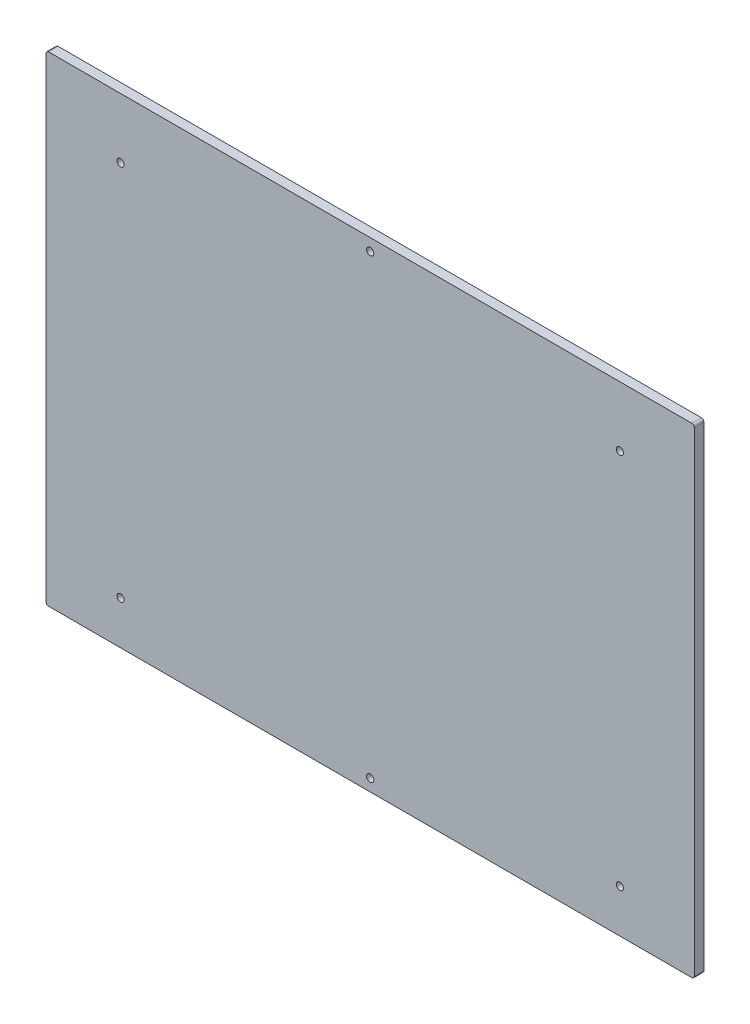
from build123d import *

# Parameters (mm, degrees)
SKETCH_1_W             = 270
SKETCH_1_H             = 200
SM_BASE_FLANGE_1_DEPTH = 4
SKETCH_6_R             = 1.5
CUT_EXTRUDE_1_DEPTH    = 10
FILLET_1_R             = 1
SKETCH_7_R             = 1.5
CUT_EXTRUDE_2_DEPTH    = 10
SKETCH_8_R             = 1.5
CUT_EXTRUDE_3_DEPTH    = 10


# Sheet-metal steps are written as plain solids
with BuildPart() as part:
    # Sketch 1 → 基体-法兰1 (new body)
    with BuildSketch(Plane.XY):
        Rectangle(SKETCH_1_W, SKETCH_1_H)
    extrude(amount=-SM_BASE_FLANGE_1_DEPTH)

    # 草图6 → 切除-拉伸1 (cut)
    with BuildSketch(Plane.XY):
        with Locations((0, 95)):
            Circle(SKETCH_6_R)
    cut_extrude_1 = extrude(amount=-CUT_EXTRUDE_1_DEPTH, mode=Mode.SUBTRACT)

    # 镜向1: 切除-拉伸1 across plane
    add(cut_extrude_1.mirror(Plane.ZX), mode=Mode.SUBTRACT)

    # 圆角1
    fillet_1_edges = [part.edges().sort_by_distance(p)[0] for p in [
        (135, -100, -2),
        (-135, -100, -2),
        (-135, 100, -2),
        (135, 100, -2),
    ]]
    fillet(fillet_1_edges, radius=FILLET_1_R)

    # 草图7 → 切除-拉伸2 (cut)
    with BuildSketch(Plane(origin=(0, 0, -4), x_dir=(-1, 0, 0), z_dir=(0, 0, -1))):
        with Locations((-104, 75)):
            Circle(SKETCH_7_R)
    cut_extrude_2 = extrude(amount=-CUT_EXTRUDE_2_DEPTH, mode=Mode.SUBTRACT)

    # 镜向2: 切除-拉伸2 across plane
    add(cut_extrude_2.mirror(Plane(origin=(0, 0, 0), x_dir=(0, 0, 1), z_dir=(1, 0, 0))), mode=Mode.SUBTRACT)

    # 草图8 → 切除-拉伸3 (cut)
    with BuildSketch(Plane(origin=(0, 0, -4), x_dir=(-1, 0, 0), z_dir=(0, 0, -1))):
        with Locations((-104, -82)):
            Circle(SKETCH_8_R)
    cut_extrude_3 = extrude(amount=-CUT_EXTRUDE_3_DEPTH, mode=Mode.SUBTRACT)

    # 镜向3: 切除-拉伸3 across plane
    add(cut_extrude_3.mirror(Plane(origin=(0, 0, 0), x_dir=(0, 0, 1), z_dir=(1, 0, 0))), mode=Mode.SUBTRACT)


solid = part.part
